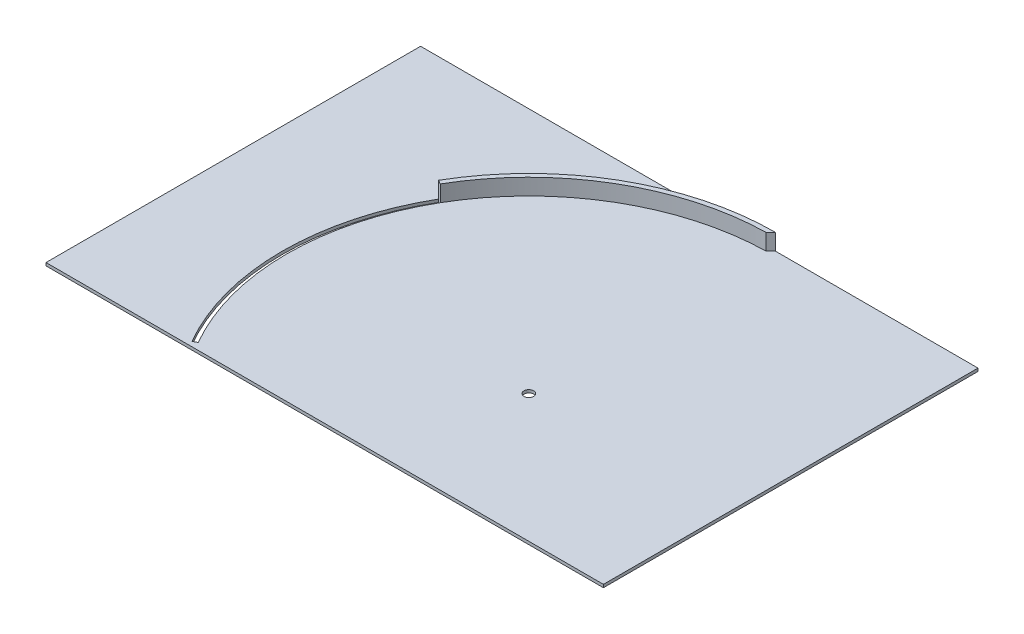
from build123d import *

# Parameters (mm, degrees)
BOSS_EXTRUDE1_DEPTH    = 35
SKETCH4_W              = 1200
SKETCH4_H              = 806.4
BOSS_EXTRUDE2_DEPTH    = 6.35
CHAMFER1_SIZE          = 10
F_20_0MM_DOWEL_HOLE1_D = 21
CUT_EXTRUDE1_DEPTH     = 932.12242208


with BuildPart() as part:
    # Sketch3 → Boss-Extrude1 (new body)
    with BuildSketch(Plane(origin=(0, 0, 0), x_dir=(1, 0, 0), z_dir=(0, 1, 0))):
        with BuildLine():
            Line((0, 531), (0, 521))
            ThreePointArc((0, 521), (-260.5, 451.199235372), (-451.199235372, 260.5))
            Line((-451.199235372, 260.5), (-459.85948941, 265.5))
            ThreePointArc((-459.85948941, 265.5), (-265.5, 459.85948941), (0, 531))
        make_face()
    extrude(amount=BOSS_EXTRUDE1_DEPTH)

    # Sketch4 → Boss-Extrude2 (add)
    with BuildSketch(Plane(origin=(0, 0, 0), x_dir=(1, 0, 0), z_dir=(0, 1, 0))):
        with Locations((-164.07, 127.8)):
            Rectangle(SKETCH4_W, SKETCH4_H)
    extrude(amount=-BOSS_EXTRUDE2_DEPTH)

    # Chamfer1
    # the kernel refuses this chamfer: 10 mm, written as the material it takes off along each edge
    with BuildSketch(Plane(origin=(0, 0, -521), x_dir=(-0.999953038196086, 0, 0.009691305506332204), z_dir=(0, 1, 0))) as chamfer1_piece_1:
        with BuildLine():
            Line((10.098340338, 0), (-CHAMFER1_SIZE * 0.00969130550632, -CHAMFER1_SIZE * 0.999953038196))
            Line((-CHAMFER1_SIZE * 0.00969130550632, -CHAMFER1_SIZE * 0.999953038196), (0, 0))
            ThreePointArc((0, 0), (5.192000536, -0.024447522), (10.098340338, 0))
        make_face()
    extrude(amount=60.969219121, mode=Mode.SUBTRACT)

    # Ø20.0mm Dowel Hole1 (through all)
    with Locations(Plane(origin=(0, 0, 0), x_dir=(1, 0, 0), z_dir=(0, 1, 0))):
        with Locations((0, 0)):
            Hole(F_20_0MM_DOWEL_HOLE1_D / 2)

    # Sketch8 → Cut-Extrude1 (cut, through all)
    with BuildSketch(Plane(origin=(0, 0, 0), x_dir=(1, 0, 0), z_dir=(0, 1, 0))):
        with BuildLine():
            Line((-451.199235372, 260.5), (-459.85948941, 265.5))
            ThreePointArc((-459.85948941, 265.5), (-531, 0), (-459.85948941, -265.5))
            Line((-459.85948941, -265.5), (-451.199235372, -260.5))
            ThreePointArc((-451.199235372, -260.5), (-521, 0), (-451.199235372, 260.5))
        make_face()
    extrude(amount=-CUT_EXTRUDE1_DEPTH, mode=Mode.SUBTRACT)


solid = part.part
